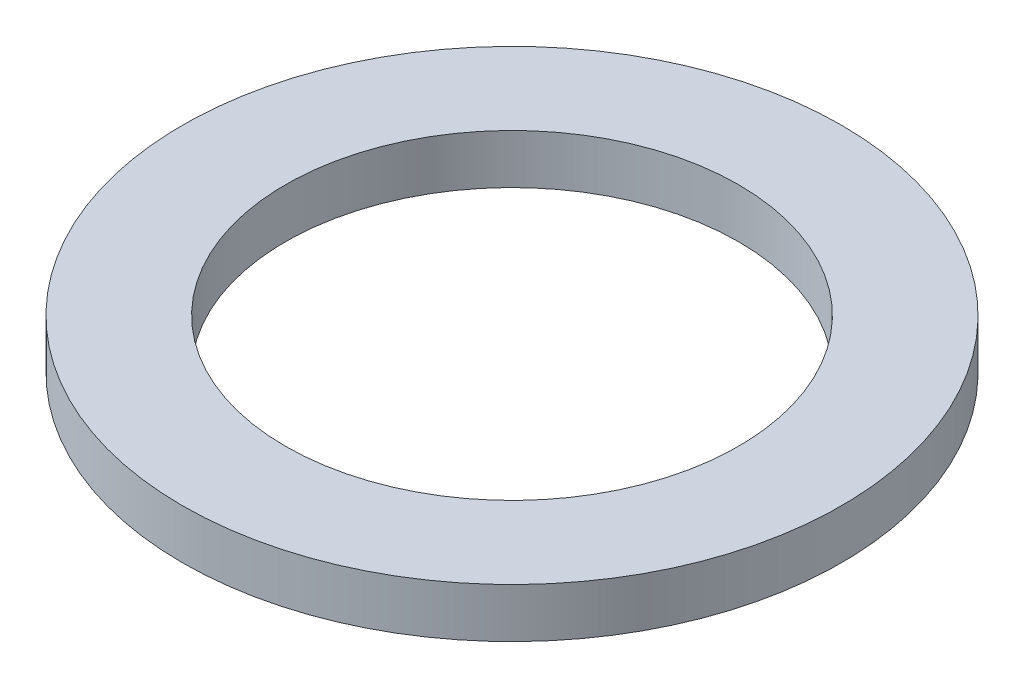
from build123d import *

# Parameters (mm, degrees)
SKETCH1_R           = 40
BOSS_EXTRUDE1_DEPTH = 6
SKETCH2_R           = 27.5
CUT_EXTRUDE1_DEPTH  = 57.885850613


with BuildPart() as part:
    # Sketch1 → Boss-Extrude1 (new body)
    with BuildSketch(Plane(origin=(0, 0, 0), x_dir=(1, 0, 0), z_dir=(0, 1, 0))):
        Circle(SKETCH1_R)
    extrude(amount=BOSS_EXTRUDE1_DEPTH)

    # Sketch2 → Cut-Extrude1 (cut, through all)
    with BuildSketch(Plane(origin=(0, 0, 0), x_dir=(1, 0, 0), z_dir=(0, 1, 0))):
        Circle(SKETCH2_R)
    extrude(amount=CUT_EXTRUDE1_DEPTH, mode=Mode.SUBTRACT)


solid = part.part
